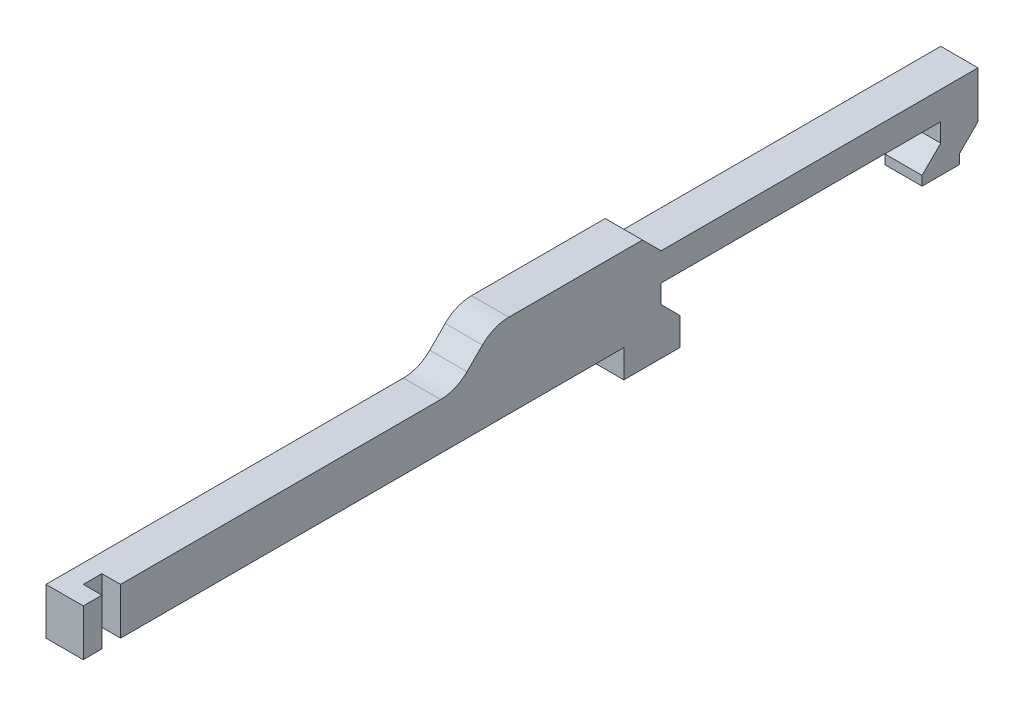
from build123d import *

# Parameters (mm, degrees)
EXTRUDE_1_DEPTH     = 2
FILLET_1_R          = 2
SKETCH_2_W          = 1
SKETCH_2_H          = 1
CUT_EXTRUDE_1_DEPTH = 49.207883173
CUT_EXTRUDE_2_DEPTH = 49.251942966


with BuildPart() as part:
    # Эскиз1 → Бобышка-Вытянуть1 (new body)
    with BuildSketch(Plane(origin=(0, 0, 0), x_dir=(0, 0, -1), z_dir=(1, 0, 0))):
        Polygon((0, 0), (29, 0), (29, -1.5), (32, -1.5), (32, 0), (31, 1), (31, 2), (46, 2), (46, 1), (45, 0), (45, -0.5), (47, -0.5), (47, 0), (48, 1), (48, 4.5), (22, 4.5), (20, 2.5), (0, 2.5), align=None)
    extrude(amount=EXTRUDE_1_DEPTH)

    # Скругление1
    fillet_1_edges = [part.edges().sort_by_distance(p)[0] for p in [
        (1, 4.5, -22),
        (1, 2.5, -20),
    ]]
    fillet(fillet_1_edges, radius=FILLET_1_R)

    # Эскиз2 → Вырез-Вытянуть1 (cut, through all)
    with BuildSketch(Plane(origin=(0, 2.5, 0), x_dir=(1, 0, 0), z_dir=(0, 1, 0))):
        with Locations((1.5, 1.5)):
            Rectangle(SKETCH_2_W, SKETCH_2_H)
    extrude(amount=-CUT_EXTRUDE_1_DEPTH, mode=Mode.SUBTRACT)

    # Эскиз3 → Вырез-Вытянуть2 (cut, through all)
    with BuildSketch(Plane(origin=(2, 0, 0), x_dir=(0, 0, -1), z_dir=(1, 0, 0))):
        Polygon((48, 4.5), (48, 3.5), (31, 3.5), (30, 4.5), (31, 4.5), align=None)
    extrude(amount=-CUT_EXTRUDE_2_DEPTH, mode=Mode.SUBTRACT)


solid = part.part
